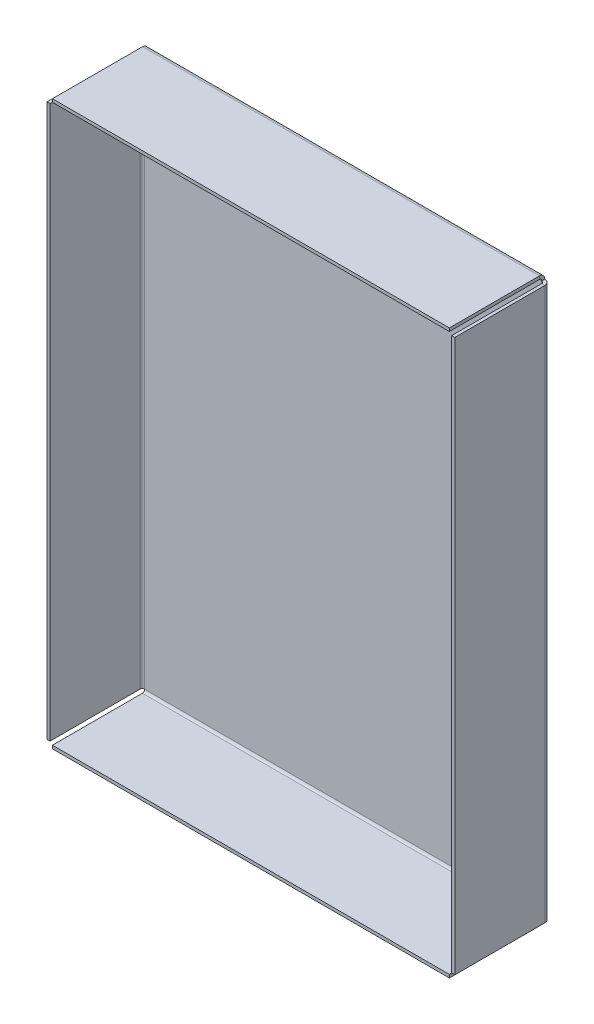
from build123d import *

# Parameters (mm, degrees)
BASE_FLANGE1_DEPTH         = 1
SKETCHED_START             = 31
SKETCHED_BEND1_DEPTH       = 178
SKETCHED_BEND1_2_DEPTH     = 128
SKETCHED_BEND1_3_DEPTH     = 178
SKETCHED_BEND1_4_OUTLINE_W = 128
SKETCHED_BEND1_4_OUTLINE_H = 1
SKETCHED_BEND1_4_DEPTH     = 29.234623369
SKETCHED_START_2           = 210.765376631
SKETCHED_BEND1_5_OUTLINE_W = 128
SKETCHED_BEND1_5_OUTLINE_H = 1
SKETCHED_BEND1_5_DEPTH     = 29.234623369
SKETCHED_BEND1_6_DEPTH     = 128
SKETCHED_BEND1_7_OUTLINE_W = 178
SKETCHED_BEND1_7_OUTLINE_H = 1
SKETCHED_BEND1_7_DEPTH     = 29.234623369
SKETCHED_START_3           = 160.765376631
SKETCHED_BEND1_8_OUTLINE_W = 178
SKETCHED_BEND1_8_OUTLINE_H = 1
SKETCHED_BEND1_8_DEPTH     = 29.234623369
SKETCH7_R                  = 10
BOSS_EXTRUDE1_DEPTH        = 3
FILLET1_R                  = 1


# Read off the part's stored shape, not the designer's step: Sketched Bend1
# Sheet-metal steps are written as plain solids
with BuildPart() as part:
    # Sketch1 → Base-Flange1 (new body)
    with BuildSketch(Plane.XY):
        Polygon((0, 209), (31, 209), (31, 240), (159, 240), (159, 209), (190, 209), (190, 31), (159, 31), (159, 0), (31, 0), (31, 31), (0, 31), align=None)
    extrude(amount=-BASE_FLANGE1_DEPTH)

    # Sketched Bend1 outline → Sketched Bend1 (add)
    with BuildSketch(Plane(origin=(0, 0, 0), x_dir=(1, 0, 0), z_dir=(0, 1, 0)).offset(SKETCHED_START)):
        with BuildLine():
            Line((29.234623369, -0.7366), (29.234623369, -29.765376631))
            Line((29.234623369, -29.765376631), (30.234623369, -29.765376631))
            Line((30.234623369, -29.765376631), (30.234623369, -0.7366))
            ThreePointArc((30.234623369, -0.7366), (30.450368514, -0.215745145), (30.971223369, 0))
            Line((30.971223369, 0), (29.398582279, 0))
            ThreePointArc((29.398582279, 0), (29.276108612, -0.359286442), (29.234623369, -0.7366))
        make_face()
        with BuildLine():
            Line((160.601417721, 0), (159.028776631, 0))
            ThreePointArc((159.028776631, 0), (159.549631486, -0.215745145), (159.765376631, -0.7366))
            Line((159.765376631, -0.7366), (159.765376631, -29.765376631))
            Line((159.765376631, -29.765376631), (160.765376631, -29.765376631))
            Line((160.765376631, -29.765376631), (160.765376631, -0.7366))
            ThreePointArc((160.765376631, -0.7366), (160.723891388, -0.359286442), (160.601417721, 0))
        make_face()
    extrude(amount=SKETCHED_BEND1_DEPTH)

    # Sketched Bend1 2 outline → Sketched Bend1 2 (add)
    with BuildSketch(Plane.YZ.offset(SKETCHED_START)):
        with BuildLine():
            Line((209.028776631, 0), (210.601417721, 0))
            ThreePointArc((210.601417721, 0), (210.723891388, 0.359286442), (210.765376631, 0.7366))
            Line((210.765376631, 0.7366), (210.765376631, 29.765376631))
            Line((210.765376631, 29.765376631), (209.765376631, 29.765376631))
            Line((209.765376631, 29.765376631), (209.765376631, 0.7366))
            ThreePointArc((209.765376631, 0.7366), (209.549631486, 0.215745145), (209.028776631, 0))
        make_face()
        with BuildLine():
            ThreePointArc((29.234623369, 0.7366), (29.276108612, 0.359286442), (29.398582279, 0))
            Line((29.398582279, 0), (30.971223369, 0))
            ThreePointArc((30.971223369, 0), (30.450368514, 0.215745145), (30.234623369, 0.7366))
            Line((30.234623369, 0.7366), (30.234623369, 29.765376631))
            Line((30.234623369, 29.765376631), (29.234623369, 29.765376631))
            Line((29.234623369, 29.765376631), (29.234623369, 0.7366))
        make_face()
    extrude(amount=SKETCHED_BEND1_2_DEPTH)

    # Sketched Bend1 3 outline → Sketched Bend1 3 (cut)
    with BuildSketch(Plane(origin=(0, 0, 0), x_dir=(1, 0, 0), z_dir=(0, 1, 0)).offset(SKETCHED_START)):
        with BuildLine():
            Line((0, 0), (29.398582279, 0))
            ThreePointArc((29.398582279, 0), (30.039397205, 0.728828115), (30.971223369, 1))
            Line((30.971223369, 1), (0, 1))
            Line((0, 1), (0, 0))
        make_face()
        with BuildLine():
            Line((190, 1), (159.028776631, 1))
            ThreePointArc((159.028776631, 1), (159.960602795, 0.728828115), (160.601417721, 0))
            Line((160.601417721, 0), (190, 0))
            Line((190, 0), (190, 1))
        make_face()
    extrude(amount=SKETCHED_BEND1_3_DEPTH, mode=Mode.SUBTRACT)

    # Sketched Bend1 4 outline → Sketched Bend1 4 (cut)
    with BuildSketch(Plane(origin=(0, 0, 0), x_dir=(1, 0, 0), z_dir=(0, 1, 0))):
        with Locations((95, 0.5)):
            Rectangle(SKETCHED_BEND1_4_OUTLINE_W, SKETCHED_BEND1_4_OUTLINE_H)
    extrude(amount=SKETCHED_BEND1_4_DEPTH, mode=Mode.SUBTRACT)

    # Sketched Bend1 5 outline → Sketched Bend1 5 (cut)
    with BuildSketch(Plane(origin=(0, 0, 0), x_dir=(1, 0, 0), z_dir=(0, 1, 0)).offset(SKETCHED_START_2)):
        with Locations((95, 0.5)):
            Rectangle(SKETCHED_BEND1_5_OUTLINE_W, SKETCHED_BEND1_5_OUTLINE_H)
    extrude(amount=SKETCHED_BEND1_5_DEPTH, mode=Mode.SUBTRACT)

    # Sketched Bend1 6 outline → Sketched Bend1 6 (cut)
    with BuildSketch(Plane.YZ.offset(SKETCHED_START)):
        with BuildLine():
            ThreePointArc((210.601417721, 0), (209.960602795, -0.728828115), (209.028776631, -1))
            Line((209.028776631, -1), (240, -1))
            Line((240, -1), (240, 0))
            Line((240, 0), (210.601417721, 0))
        make_face()
        with BuildLine():
            Line((0, -1), (30.971223369, -1))
            ThreePointArc((30.971223369, -1), (30.039397205, -0.728828115), (29.398582279, 0))
            Line((29.398582279, 0), (0, 0))
            Line((0, 0), (0, -1))
        make_face()
    extrude(amount=SKETCHED_BEND1_6_DEPTH, mode=Mode.SUBTRACT)

    # Sketched Bend1 7 outline → Sketched Bend1 7 (cut)
    with BuildSketch(Plane.YZ):
        with Locations((120, -0.5)):
            Rectangle(SKETCHED_BEND1_7_OUTLINE_W, SKETCHED_BEND1_7_OUTLINE_H)
    extrude(amount=SKETCHED_BEND1_7_DEPTH, mode=Mode.SUBTRACT)

    # Sketched Bend1 8 outline → Sketched Bend1 8 (cut)
    with BuildSketch(Plane.YZ.offset(SKETCHED_START_3)):
        with Locations((120, -0.5)):
            Rectangle(SKETCHED_BEND1_8_OUTLINE_W, SKETCHED_BEND1_8_OUTLINE_H)
    extrude(amount=SKETCHED_BEND1_8_DEPTH, mode=Mode.SUBTRACT)

    # Sketch7 → Boss-Extrude1 (add)
    with BuildSketch(Plane(origin=(0, 0, -1), x_dir=(-1, 0, 0), z_dir=(0, 0, -1))):
        with Locations((-130.765376631, 160.765376631)):
            Circle(SKETCH7_R)
        with Locations((-95.765376631, 160.765376631)):
            Circle(SKETCH7_R)
        with Locations((-60.765376631, 160.765376631)):
            Circle(SKETCH7_R)
    extrude(amount=BOSS_EXTRUDE1_DEPTH)

    # Fillet1
    fillet1_edges = [part.edges().sort_by_distance(p)[0] for p in [
        (140.765376631, 160.765376631, -4),
        (105.765376631, 160.765376631, -4),
        (70.765376631, 160.765376631, -4),
    ]]
    fillet(fillet1_edges, radius=FILLET1_R)


solid = part.part
